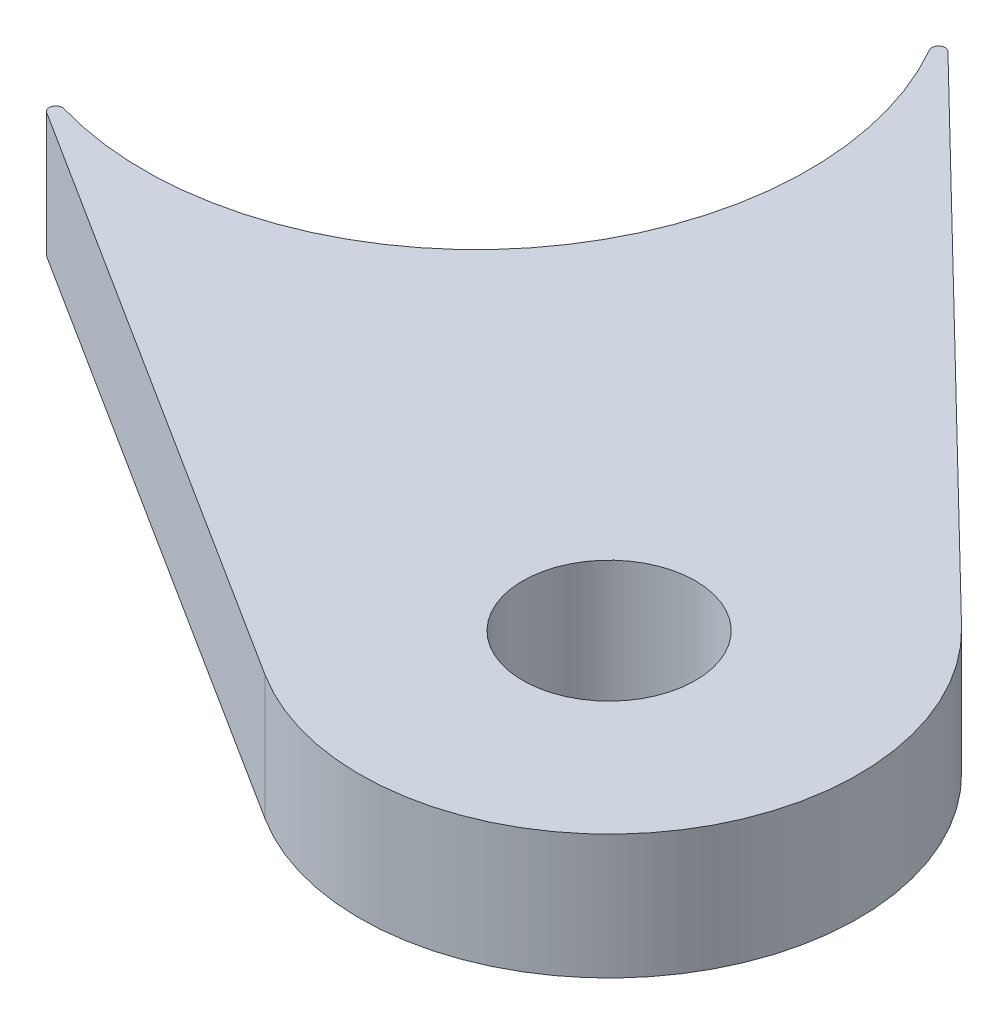
from build123d import *

# Parameters (mm, degrees)
SKETCH1_R           = 3.3
BOSS_EXTRUDE1_DEPTH = 4.7625
FILLET1_R           = 0.254


with BuildPart() as part:
    # Sketch1 → Boss-Extrude1 (new body)
    with BuildSketch(Plane(origin=(0, 0, 0), x_dir=(1, 0, 0), z_dir=(0, 1, 0))):
        with BuildLine():
            Line((20.295130547, -4.286001307), (-1.62065927, 17.039498258))
            ThreePointArc((-1.62065927, 17.039498258), (-0.509488878, 0.068017535), (-17.27546701, -2.789924879))
            Line((-17.27546701, -2.789924879), (8.554024743, -19.158068659))
            ThreePointArc((8.554024743, -19.158068659), (21.128508342, -17.014611849), (20.295130547, -4.286001307))
        make_face()
        with Locations((13.6525, -11.1125)):
            Circle(SKETCH1_R, mode=Mode.SUBTRACT)
    extrude(amount=BOSS_EXTRUDE1_DEPTH)

    # Fillet1
    fillet1_edges = [part.edges().sort_by_distance(p)[0] for p in [
        (-17.27546701, 2.38125, 2.789924879),
        (-1.62065927, 2.38125, -17.039498258),
    ]]
    fillet(fillet1_edges, radius=FILLET1_R)


solid = part.part
